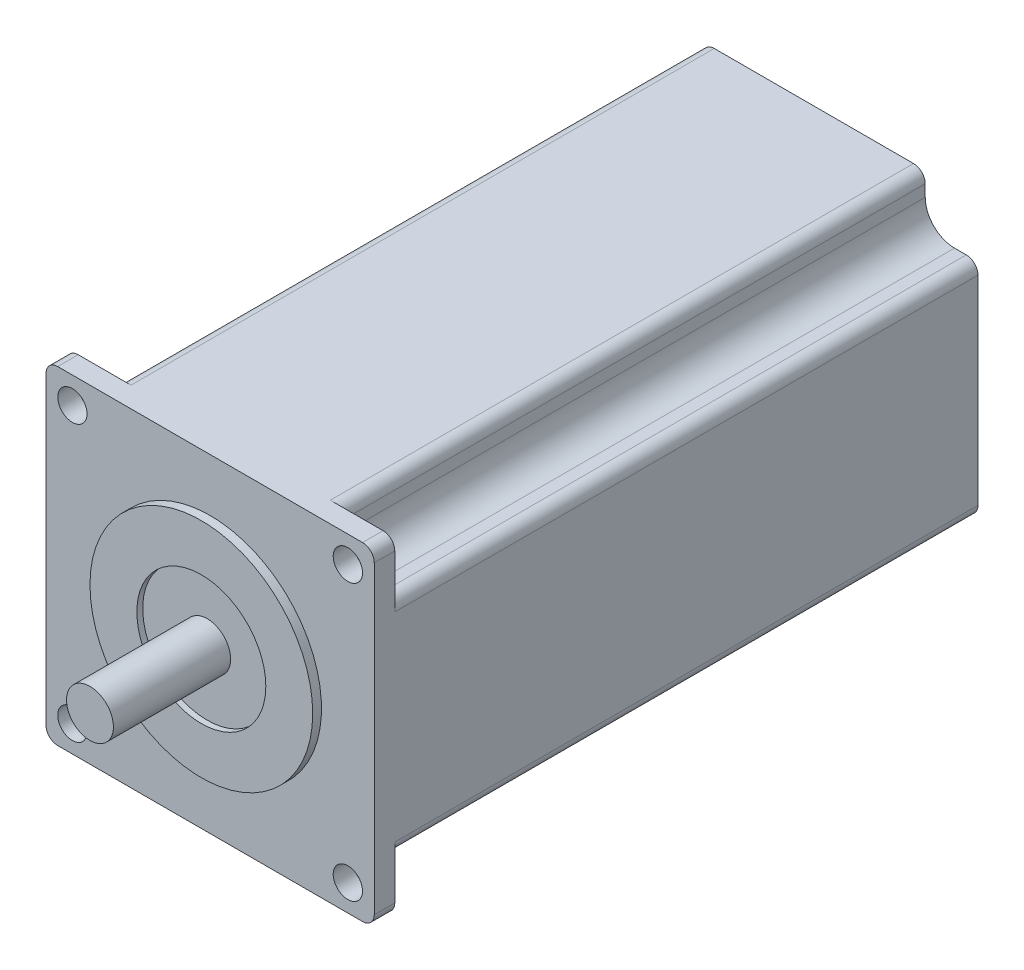
from build123d import *

# Parameters (mm, degrees)
SKETCH_1_W                = 56
SKETCH_1_H                = 56
EXTRUDE_1_DEPTH           = 103
SKETCH_2_W                = 9
SKETCH_2_H                = 9
CUT_EXTRUDE_1_DEPTH       = 99.5
HOLE_WIZARD_5_0_5_1_D     = 5
HOLE_WIZARD_5_0_5_1_DEPTH = 10
HOLE_WIZARD_5_0_5_1_TIP   = 1.502151548
FILLET_2_R                = 5
SKETCH_5_R                = 19
EXTRUDE_2_DEPTH           = 1.5
SKETCH_6_R                = 11
CUT_EXTRUDE_2_DEPTH       = 1
SKETCH_7_R                = 4
EXTRUDE_3_DEPTH           = 20
FILLET_3_R                = 2
SKETCH_8_R                = 26
EXTRUDE_4_DEPTH           = 1.5
CHAMFER_1_SIZE2           = 5.598076211
CHAMFER_1_SIZE            = 1.5


with BuildPart() as part:
    # 草图1 → 凸台-拉伸1 (new body)
    with BuildSketch(Plane.XY):
        with Locations((28, 28)):
            Rectangle(SKETCH_1_W, SKETCH_1_H)
    extrude(amount=EXTRUDE_1_DEPTH)

    # 草图2 → 切除-拉伸1 (cut)
    with BuildSketch(Plane(origin=(0, 0, 0), x_dir=(-1, 0, 0), z_dir=(0, 0, -1))):
        with Locations((-51.5, 4.5)):
            Rectangle(SKETCH_2_W, SKETCH_2_H)
        with Locations((-51.5, 51.5)):
            Rectangle(SKETCH_2_W, SKETCH_2_H)
        with Locations((-4.5, 51.5)):
            Rectangle(SKETCH_2_W, SKETCH_2_H)
        with Locations((-4.5, 4.5)):
            Rectangle(SKETCH_2_W, SKETCH_2_H)
    extrude(amount=-CUT_EXTRUDE_1_DEPTH, mode=Mode.SUBTRACT)

    # Ø5.0 (5) 直径孔1
    with Locations(Plane.XY.offset(103)):
        with Locations((4.5, 51.5), (51.5, 51.5), (51.5, 4.5), (4.5, 4.5)):
            Hole(HOLE_WIZARD_5_0_5_1_D / 2, depth=HOLE_WIZARD_5_0_5_1_DEPTH)
            with Locations((0, 0, -(HOLE_WIZARD_5_0_5_1_DEPTH + HOLE_WIZARD_5_0_5_1_TIP / 2))):  # 118° drill point
                Cone(0, HOLE_WIZARD_5_0_5_1_D / 2, HOLE_WIZARD_5_0_5_1_TIP, mode=Mode.SUBTRACT)

    # 圆角2
    fillet_2_edges = [part.edges().sort_by_distance(p)[0] for p in [
        (47, 9, 49.75),
        (47, 47, 49.75),
        (9, 47, 49.75),
        (9, 9, 49.75),
    ]]
    fillet(fillet_2_edges, radius=FILLET_2_R)

    # 草图5 → 凸台-拉伸2 (add)
    with BuildSketch(Plane.XY.offset(103)):
        with Locations(Location((28, 28, 0), (0, 0, 180))):
            Circle(SKETCH_5_R)
    extrude(amount=EXTRUDE_2_DEPTH)

    # 草图6 → 切除-拉伸2 (cut)
    with BuildSketch(Plane.XY.offset(104.5)):
        with Locations((28, 28)):
            Circle(SKETCH_6_R)
    extrude(amount=-CUT_EXTRUDE_2_DEPTH, mode=Mode.SUBTRACT)

    # 草图7 → 凸台-拉伸3 (add)
    with BuildSketch(Plane.XY.offset(103.5)):
        with Locations((28, 28)):
            Circle(SKETCH_7_R)
    extrude(amount=EXTRUDE_3_DEPTH)

    # 圆角3
    fillet_3_edges = [part.edges().sort_by_distance(p)[0] for p in [
        (56, 9, 49.75),
        (47, 0, 49.75),
        (56, 47, 49.75),
        (47, 56, 49.75),
        (0, 47, 49.75),
        (9, 56, 49.75),
        (0, 9, 49.75),
        (9, 0, 49.75),
        (0, 56, 101.25),
        (56, 56, 101.25),
        (56, 0, 101.25),
        (0, 0, 101.25),
    ]]
    fillet(fillet_3_edges, radius=FILLET_3_R)

    # 草图8 → 凸台-拉伸4 (add)
    with BuildSketch(Plane(origin=(0, 0, 0), x_dir=(-1, 0, 0), z_dir=(0, 0, -1))):
        with Locations((-28, 28)):
            Circle(SKETCH_8_R)
    extrude(amount=EXTRUDE_4_DEPTH)

    # 倒角1
    chamfer_1_edges = [part.edges().sort_by_distance(p)[0] for p in [
        (54, 28, -1.5),
    ]]
    chamfer_1_side = [part.faces().sort_by_distance(p)[0] for p in [
        (54, 28, -1.47),
    ]]
    chamfer(chamfer_1_edges, length=CHAMFER_1_SIZE - 0.0001, length2=CHAMFER_1_SIZE2 - 0.0001, reference=chamfer_1_side[0])  # a hair under: the kernel refuses the full size


solid = part.part
